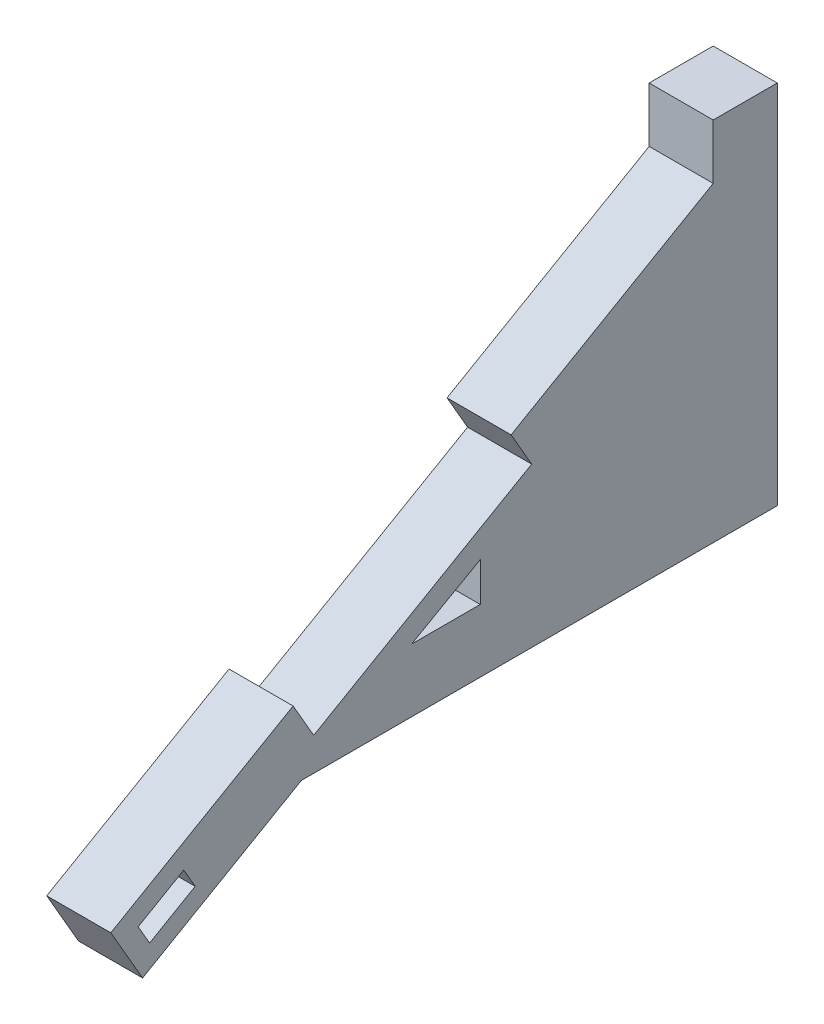
from build123d import *

# Parameters (mm, degrees)
BOSS_EXTRUDE1_DEPTH = 7


with BuildPart() as part:
    # Sketch1 → Boss-Extrude1 (new body)
    with BuildSketch(Plane(origin=(0, 0, 0), x_dir=(0, 0, -1), z_dir=(1, 0, 0))):
        Polygon((0, 0), (0, 40), (-7, 40), (-7, 34), (-29.083647797, 21.25), (-26.833647797, 17.352885683), (-50.649346401, 3.602885683), (-52.899346401, 7.5), (-72.817930688, -4), (-69.345498823, -10.014428415), (-52, 0), align=None)
        Polygon((-69.828328815, -4.926142338), (-64.848682743, -2.051142338), (-63.598682743, -4.216205848), (-68.578328815, -7.091205848), align=None, mode=Mode.SUBTRACT)
        Polygon((-39.949930688, 6.884), (-32.449930688, 11.134), (-32.449930688, 6.884), align=None, mode=Mode.SUBTRACT)
    extrude(amount=-BOSS_EXTRUDE1_DEPTH)


solid = part.part
